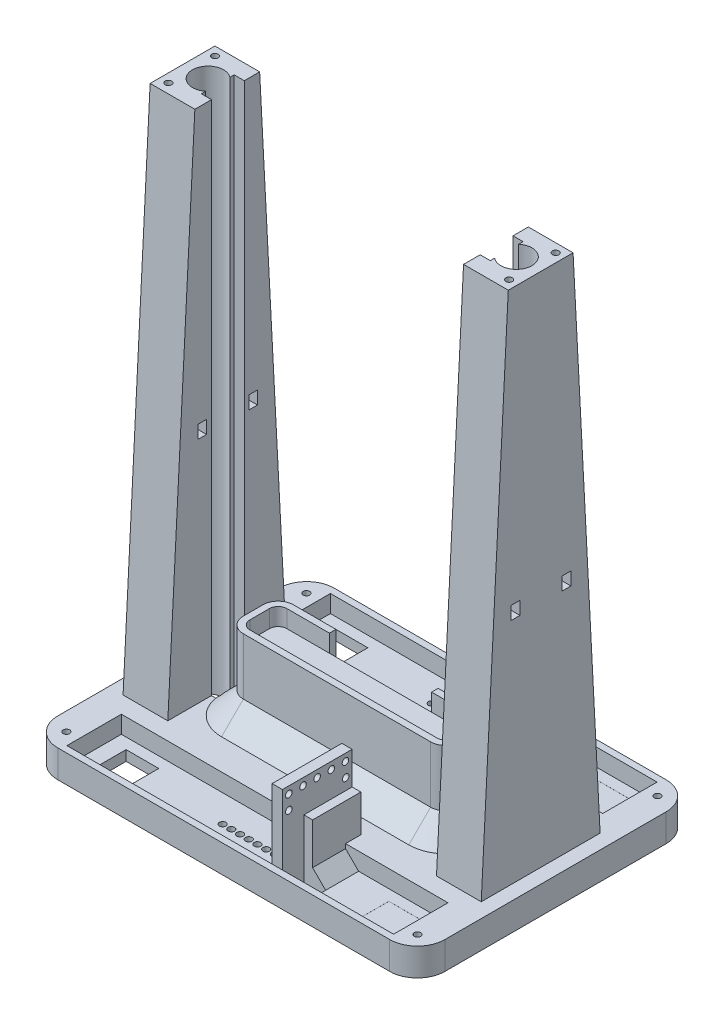
from build123d import *

# Parameters (mm, degrees)
BOSS_EXTRUDE1_DEPTH      = 12.7
SKETCH4_W                = 90
SKETCH4_H                = 13
CUT_EXTRUDE3_DEPTH       = 8
SKETCH5_W                = 5
SKETCH5_H                = 50
CUT_EXTRUDE4_DEPTH       = 8
FILLET2_R                = 2
SKETCH8_W                = 150
SKETCH8_H                = 25
CUT_EXTRUDE7_DEPTH       = 8
SKETCH9_R                = 1.5
CUT_EXTRUDE8_DEPTH       = 8
SKETCH10_W               = 15
SKETCH10_H               = 15
CUT_EXTRUDE9_DEPTH       = 8
CUT_EXTRUDE10_DEPTH      = 110.542046722
CUT_EXTRUDE10_DEPTH_BACK = 110.542046722
SKETCH11_R               = 2
SKETCH13_W               = 24.695901855
SKETCH13_H               = 54.590940943
BOSS_EXTRUDE2_DEPTH      = 242
CUT_EXTRUDE11_DEPTH      = 314.35205833
SKETCH21_W               = 4
SKETCH21_H               = 6
CUT_EXTRUDE12_DEPTH      = 297.352871748
CUT_EXTRUDE13_DEPTH      = 273.553756166
CUT_EXTRUDE13_DEPTH_BACK = 273.553756166
CUT_EXTRUDE14_DEPTH      = 273.553756166
CUT_EXTRUDE14_DEPTH_BACK = 9
SKETCH26_R               = 1.5
CUT_EXTRUDE15_START      = -237
SKETCH28_W               = 11.19655972
SKETCH28_H               = 71
CUT_EXTRUDE15_DEPTH      = 237
SKETCH29_W               = 4.719264859
SKETCH29_H               = 32
BOSS_EXTRUDE3_DEPTH      = 40
CHAMFER1_SIZE            = 10
SKETCH31_W               = 32
SKETCH31_H               = 27.767359559
BOSS_EXTRUDE4_DEPTH      = 4
SKETCH30_R               = 1.5
CUT_EXTRUDE16_DEPTH      = 6
CUT_EXTRUDE17_DEPTH      = 246.632774686
FILLET3_R                = 10
SKETCH36_W               = 25.345030469
SKETCH36_H               = 4.676078079
BOSS_EXTRUDE5_DEPTH      = 21
BOSS_EXTRUDE6_DEPTH      = 36
SKETCH38_R               = 1.5
CUT_EXTRUDE18_DEPTH      = 282.27662012
CHAMFER4_SIZE            = 10
SKETCH39_W               = 94.949747468
SKETCH39_H               = 17.949747468
BOSS_EXTRUDE7_DEPTH      = 36
SKETCH40_R               = 1.5
CUT_EXTRUDE19_DEPTH      = 261.968312253


with BuildPart() as part:
    # Sketch1 → Boss-Extrude1 (new body)
    with BuildSketch(Plane(origin=(0, 0, 0), x_dir=(1, 0, 0), z_dir=(0, 1, 0))):
        with BuildLine():
            Line((-76.2, 63.5), (76.2, 63.5))
            ThreePointArc((76.2, 63.5), (85.180256121, 59.780256121), (88.9, 50.8))
            Line((88.9, 50.8), (88.9, -50.8))
            ThreePointArc((88.9, -50.8), (85.180256121, -59.780256121), (76.2, -63.5))
            Line((76.2, -63.5), (-76.2, -63.5))
            ThreePointArc((-76.2, -63.5), (-85.180256121, -59.780256121), (-88.9, -50.8))
            Line((-88.9, -50.8), (-88.9, 50.8))
            ThreePointArc((-88.9, 50.8), (-85.180256121, 59.780256121), (-76.2, 63.5))
        make_face()
    extrude(amount=BOSS_EXTRUDE1_DEPTH)

    # Sketch4 → Cut-Extrude3 (cut)
    with BuildSketch(Plane(origin=(0, 12.7, 0), x_dir=(1, 0, 0), z_dir=(0, 1, 0))):
        Rectangle(SKETCH4_W, SKETCH4_H)
    extrude(amount=-CUT_EXTRUDE3_DEPTH, mode=Mode.SUBTRACT)

    # Sketch5 → Cut-Extrude4 (cut)
    with BuildSketch(Plane(origin=(0, 12.7, 0), x_dir=(1, 0, 0), z_dir=(0, 1, 0))):
        with Locations((-18.967535471, 31.5)):
            Rectangle(SKETCH5_W, SKETCH5_H)
        with Locations((18.967535471, 31.5)):
            Rectangle(SKETCH5_W, SKETCH5_H)
    extrude(amount=-CUT_EXTRUDE4_DEPTH, mode=Mode.SUBTRACT)

    # Fillet2
    fillet2_edges = [part.edges().sort_by_distance(p)[0] for p in [
        (-45, 4.7, 0),
        (-45, 8.7, 6.5),
        (33.233767736, 4.7, -6.5),
        (-45, 8.7, -6.5),
        (45, 4.7, 0),
        (45, 8.7, -6.5),
        (0, 4.7, 6.5),
        (45, 8.7, 6.5),
        (-45, 12.7, 0),
        (0, 12.7, 6.5),
        (45, 12.7, 0),
        (33.233767736, 12.7, -6.5),
        (0, 4.7, -6.5),
        (-33.233767736, 4.7, -6.5),
        (0, 12.7, -6.5),
        (-33.233767736, 12.7, -6.5),
        (-16.467535471, 8.7, -56.5),
        (-16.467535471, 8.7, -6.5),
        (-21.467535471, 8.7, -6.5),
        (-21.467535471, 8.7, -56.5),
        (-16.467535471, 12.7, -31.5),
        (-18.967535471, 12.7, -56.5),
        (-21.467535471, 12.7, -31.5),
        (-16.467535471, 4.7, -31.5),
        (-21.467535471, 4.7, -31.5),
        (-18.967535471, 4.7, -56.5),
        (16.467535471, 8.7, -6.5),
        (16.467535471, 8.7, -56.5),
        (21.467535471, 8.7, -56.5),
        (21.467535471, 8.7, -6.5),
        (16.467535471, 12.7, -31.5),
        (21.467535471, 12.7, -31.5),
        (18.967535471, 12.7, -56.5),
        (16.467535471, 4.7, -31.5),
        (18.967535471, 4.7, -56.5),
        (21.467535471, 4.7, -31.5),
    ]]
    fillet(fillet2_edges, radius=FILLET2_R)

    # Sketch8 → Cut-Extrude7 (cut)
    with BuildSketch(Plane(origin=(0, 12.7, 0), x_dir=(1, 0, 0), z_dir=(0, 1, 0))):
        with Locations((0, -48)):
            Rectangle(SKETCH8_W, SKETCH8_H)
        with Locations((0, 48)):
            Rectangle(SKETCH8_W, SKETCH8_H)
    extrude(amount=-CUT_EXTRUDE7_DEPTH, mode=Mode.SUBTRACT)

    # Sketch9 → Cut-Extrude8 (cut)
    with BuildSketch(Plane(origin=(0, 4.7, 0), x_dir=(1, 0, 0), z_dir=(0, 1, 0))):
        with Locations(Location((0, -48, 0), (0, 0, 270))):
            Circle(SKETCH9_R)
        with Locations(Location((4, -48, 0), (0, 0, 270))):
            Circle(SKETCH9_R)
        with Locations(Location((8, -48, 0), (0, 0, 270))):
            Circle(SKETCH9_R)
        with Locations(Location((12, -48, 0), (0, 0, 270))):
            Circle(SKETCH9_R)
        with Locations(Location((16, -48, 0), (0, 0, 270))):
            Circle(SKETCH9_R)
        with Locations(Location((-16, -48, 0), (0, 0, 270))):
            Circle(SKETCH9_R)
        with Locations(Location((-12, -48, 0), (0, 0, 270))):
            Circle(SKETCH9_R)
        with Locations(Location((-8, -48, 0), (0, 0, 270))):
            Circle(SKETCH9_R)
        with Locations(Location((-4, -48, 0), (0, 0, 270))):
            Circle(SKETCH9_R)
        with Locations(Location((-4, 48, 0), (0, 0, 270))):
            Circle(SKETCH9_R)
        with Locations(Location((-8, 48, 0), (0, 0, 270))):
            Circle(SKETCH9_R)
        with Locations(Location((-12, 48, 0), (0, 0, 270))):
            Circle(SKETCH9_R)
        with Locations(Location((-16, 48, 0), (0, 0, 270))):
            Circle(SKETCH9_R)
        with Locations(Location((16, 48, 0), (0, 0, 270))):
            Circle(SKETCH9_R)
        with Locations(Location((12, 48, 0), (0, 0, 270))):
            Circle(SKETCH9_R)
        with Locations(Location((8, 48, 0), (0, 0, 270))):
            Circle(SKETCH9_R)
        with Locations(Location((4, 48, 0), (0, 0, 270))):
            Circle(SKETCH9_R)
        with Locations(Location((0, 48, 0), (0, 0, 270))):
            Circle(SKETCH9_R)
    extrude(amount=-CUT_EXTRUDE8_DEPTH, mode=Mode.SUBTRACT)

    # Sketch10 → Cut-Extrude9 (cut)
    with BuildSketch(Plane(origin=(0, 4.7, 0), x_dir=(1, 0, 0), z_dir=(0, 1, 0))):
        with Locations((-60.317583888, -48)):
            Rectangle(SKETCH10_W, SKETCH10_H)
        with Locations((60.317583888, -48)):
            Rectangle(SKETCH10_W, SKETCH10_H)
        with Locations((60.317583888, 48)):
            Rectangle(SKETCH10_W, SKETCH10_H)
        with Locations((-60.317583888, 48)):
            Rectangle(SKETCH10_W, SKETCH10_H)
    extrude(amount=-CUT_EXTRUDE9_DEPTH, mode=Mode.SUBTRACT)

    # Sketch11 → Cut-Extrude10 (cut, two sides: drawn at the far end of the back side and taken through both)
    with BuildSketch(Plane(origin=(0, 4.7, 0), x_dir=(1, 0, 0), z_dir=(0, 1, 0)).offset(-CUT_EXTRUDE10_DEPTH_BACK)):
        with Locations(Location((-19.497261117, 37.214545157, 0), (0, 0, 270))):
            Circle(SKETCH11_R)
        with Locations(Location((18.951015186, 37.432150821, 0), (0, 0, 270))):
            Circle(SKETCH11_R)
    extrude(amount=CUT_EXTRUDE10_DEPTH + CUT_EXTRUDE10_DEPTH_BACK, mode=Mode.SUBTRACT)

    # Sketch13 → Boss-Extrude2 (add)
    with BuildSketch(Plane(origin=(0, 12.7, 0), x_dir=(1, 0, 0), z_dir=(0, 1, 0))):
        with Locations((-69.881159569, -0.185683473)):
            Rectangle(SKETCH13_W, SKETCH13_H)
    boss_extrude2 = extrude(amount=BOSS_EXTRUDE2_DEPTH)

    # Sketch17 → Cut-Extrude11 (cut, symmetric)
    with BuildSketch(Plane.ZY.offset(82.229110497)):
        Polygon((-27.109786999, 12.7), (-14.689143309, 249.7), (15.060510254, 249.7), (27.481153944, 12.7), (27.481153944, 254.7), (-27.109786999, 254.7), align=None)
    cut_extrude11 = extrude(amount=CUT_EXTRUDE11_DEPTH, both=True, mode=Mode.SUBTRACT)

    # Mirror1: Boss-Extrude2, Cut-Extrude11 across plane
    add(boss_extrude2.mirror(Plane(origin=(0, 0, 0), x_dir=(0, 0, 1), z_dir=(1, 0, 0))))
    add(cut_extrude11.mirror(Plane(origin=(0, 0, 0), x_dir=(0, 0, 1), z_dir=(1, 0, 0))), mode=Mode.SUBTRACT)

    # Sketch21 → Cut-Extrude12 (cut, symmetric)
    with BuildSketch(Plane.ZY.offset(-57.533208642)):
        with Locations((11.706235249, 120.7)):
            Rectangle(SKETCH21_W, SKETCH21_H)
    cut_extrude12 = extrude(amount=CUT_EXTRUDE12_DEPTH, both=True, mode=Mode.SUBTRACT)

    # Mirror2: Cut-Extrude12 across plane
    add(cut_extrude12.mirror(Plane.XY), mode=Mode.SUBTRACT)

    # Sketch25 → Cut-Extrude13 (cut, two sides: drawn at the far end of the back side and taken through both)
    with BuildSketch(Plane(origin=(0, 249.7, 0), x_dir=(1, 0, 0), z_dir=(0, 1, 0)).offset(-CUT_EXTRUDE13_DEPTH_BACK)):
        with BuildLine():
            Line((-66.3346358, -5.419713844), (-66.3346358, -7.436467572))
            Line((-66.3346358, -7.436467572), (-57.317356687, -7.436467572))
            Line((-57.317356687, -7.436467572), (-57.317356687, 7.648938074))
            Line((-57.317356687, 7.648938074), (-66.3346358, 7.648938074))
            Line((-66.3346358, 7.648938074), (-66.3346358, 5.632184346))
            ThreePointArc((-66.3346358, 5.632184346), (-77.926558496, 0.106235251), (-66.3346358, -5.419713844))
        make_face()
        with BuildLine():
            Line((66.3346358, 7.648938074), (66.3346358, 5.632184346))
            ThreePointArc((66.3346358, 5.632184346), (77.926558496, 0.106235251), (66.3346358, -5.419713844))
            Line((66.3346358, -5.419713844), (66.3346358, -7.436467572))
            Line((66.3346358, -7.436467572), (57.317356687, -7.436467572))
            Line((57.317356687, -7.436467572), (57.317356687, 7.648938074))
            Line((57.317356687, 7.648938074), (66.3346358, 7.648938074))
        make_face()
    extrude(amount=CUT_EXTRUDE13_DEPTH + CUT_EXTRUDE13_DEPTH_BACK, mode=Mode.SUBTRACT)

    # Sketch26 → Cut-Extrude14 (cut, two sides: drawn at the far end of the back side and taken through both)
    with BuildSketch(Plane(origin=(0, 249.7, 0), x_dir=(1, 0, 0), z_dir=(0, 1, 0)).offset(-CUT_EXTRUDE14_DEPTH_BACK)):
        with Locations(Location((-78.229110497, 10.689143309, 0), (0, 0, 90))):
            Circle(SKETCH26_R)
        with Locations(Location((-78.229110497, -10.689143309, 0), (0, 0, 90))):
            Circle(SKETCH26_R)
        with Locations(Location((78.229110497, -10.689143309, 0), (0, 0, 90))):
            Circle(SKETCH26_R)
        with Locations(Location((78.229110497, 10.689143309, 0), (0, 0, 90))):
            Circle(SKETCH26_R)
    extrude(amount=CUT_EXTRUDE14_DEPTH + CUT_EXTRUDE14_DEPTH_BACK, mode=Mode.SUBTRACT)

    # Sketch28 → Cut-Extrude15 (cut)
    with BuildSketch(Plane(origin=(0, 249.7, 0), x_dir=(1, 0, 0), z_dir=(0, 1, 0)).offset(CUT_EXTRUDE15_START)):
        with Locations((-56.08903549, 0)):
            Rectangle(SKETCH28_W, SKETCH28_H)
    cut_extrude15 = extrude(amount=CUT_EXTRUDE15_DEPTH, mode=Mode.SUBTRACT)

    # Mirror3: Cut-Extrude15 across plane
    add(cut_extrude15.mirror(Plane(origin=(0, 0, 0), x_dir=(0, 0, 1), z_dir=(1, 0, 0))), mode=Mode.SUBTRACT)

    # Sketch29 → Boss-Extrude3 (add)
    with BuildSketch(Plane(origin=(0, 4.7, 0), x_dir=(1, 0, 0), z_dir=(0, 1, 0))):
        with Locations((21.586267037, -44.47650522)):
            Rectangle(SKETCH29_W, SKETCH29_H)
    boss_extrude3 = extrude(amount=BOSS_EXTRUDE3_DEPTH)

    # Chamfer1
    chamfer1_edges = [part.edges().sort_by_distance(p)[0] for p in [
        (23.945899466, 4.7, 47.98825261),
    ]]
    chamfer(chamfer1_edges, length=CHAMFER1_SIZE)

    # Sketch31 → Boss-Extrude4 (add)
    with BuildSketch(Plane(origin=(23.945899466, 0, 0), x_dir=(0, 0, -1), z_dir=(1, 0, 0))):
        with Locations((-44.47650522, 15.816320221)):
            Rectangle(SKETCH31_W, SKETCH31_H)
    boss_extrude4 = extrude(amount=BOSS_EXTRUDE4_DEPTH)

    # Sketch30 → Cut-Extrude16 (cut)
    with BuildSketch(Plane(origin=(23.945899466, 0, 0), x_dir=(0, 0, -1), z_dir=(1, 0, 0))):
        with Locations((-44.534122475, 41.44870389)):
            Circle(SKETCH30_R)
        with Locations((-51.034122475, 41.44870389)):
            Circle(SKETCH30_R)
        with Locations((-57.534122475, 41.44870389)):
            Circle(SKETCH30_R)
        with Locations((-57.534122475, 34.94870389)):
            Circle(SKETCH30_R)
        with Locations((-38.034370442, 41.391927945)):
            Circle(SKETCH30_R)
        with Locations((-31.534374224, 41.384916129)):
            Circle(SKETCH30_R)
    cut_extrude16 = extrude(amount=-CUT_EXTRUDE16_DEPTH, mode=Mode.SUBTRACT)

    # Sketch34 → Cut-Extrude17 (cut, through all)
    with BuildSketch(Plane(origin=(0, 29.7, 0), x_dir=(1, 0, 0), z_dir=(0, 1, 0))):
        Polygon((23.945899466, -50.632656718), (30.945899466, -50.632656718), (33.945899466, -50.632656718), (33.945899466, -60.47650522), (30.945899466, -60.47650522), (23.945899466, -60.47650522), align=None)
    cut_extrude17 = extrude(amount=-CUT_EXTRUDE17_DEPTH, mode=Mode.SUBTRACT)

    # Mirror9: Boss-Extrude3, Boss-Extrude4, Cut-Extrude16, Cut-Extrude17 across plane
    add(boss_extrude3.mirror(Plane.XY))
    add(boss_extrude4.mirror(Plane.XY))
    add(cut_extrude16.mirror(Plane.XY), mode=Mode.SUBTRACT)
    add(cut_extrude17.mirror(Plane.XY), mode=Mode.SUBTRACT)

    # Fillet3
    # the kernel refuses this fillet: 10 mm, written as the material it adds along each edge
    with BuildSketch(Plane(origin=(27.945899466, 4.7, -50.632656718), x_dir=(0, 1, 0), z_dir=(0, 0, 1))) as fillet3_piece_1_section:
        with BuildLine():
            CenterArc((FILLET3_R, -FILLET3_R), FILLET3_R, 90, 90)
            Line((0, -FILLET3_R), (0, 0))
            Line((0, 0), (FILLET3_R, 0))
        make_face()
    fillet3_piece_1 = extrude(amount=40.132656718, mode=Mode.PRIVATE)
    fillet3_piece_1 = split(fillet3_piece_1, bisect_by=Plane(origin=(28.006405342, 13.198984242, -28.47650522), z_dir=(0, 0, -1)), keep=Keep.TOP, mode=Mode.PRIVATE)
    add(fillet3_piece_1)

    # Sketch36 → Boss-Extrude5 (add)
    with BuildSketch(Plane.ZY.offset(-67.817583888)):
        with Locations((-50.585946464, 2.33803904)):
            Rectangle(SKETCH36_W, SKETCH36_H)
    boss_extrude5 = extrude(amount=BOSS_EXTRUDE5_DEPTH)

    # Mirror10: Boss-Extrude5 across plane
    add(boss_extrude5.mirror(Plane.XY))

    # Sketch37 → Boss-Extrude6 (add)
    with BuildSketch(Plane(origin=(0, 12.7, 0), x_dir=(1, 0, 0), z_dir=(0, 1, 0))):
        with BuildLine():
            Line((23.467535471, 11.5), (43, 11.5))
            ThreePointArc((43, 11.5), (47.949747468, 9.449747468), (50, 4.5))
            Line((50, 4.5), (50, -4.5))
            ThreePointArc((50, -4.5), (47.949747468, -9.449747468), (43, -11.5))
            Line((43, -11.5), (-43, -11.5))
            ThreePointArc((-43, -11.5), (-47.949747468, -9.449747468), (-50, -4.5))
            Line((-50, -4.5), (-50, 4.5))
            ThreePointArc((-50, 4.5), (-47.949747468, 9.449747468), (-43, 11.5))
            Line((-43, 11.5), (-23.467535471, 11.5))
            Line((-23.467535471, 11.5), (-23.467535471, 8.5))
            Line((-23.467535471, 8.5), (-43, 8.5))
            ThreePointArc((-43, 8.5), (-45.828427125, 7.328427125), (-47, 4.5))
            Line((-47, 4.5), (-47, -4.5))
            ThreePointArc((-47, -4.5), (-45.828427125, -7.328427125), (-43, -8.5))
            Line((-43, -8.5), (43, -8.5))
            ThreePointArc((43, -8.5), (45.828427125, -7.328427125), (47, -4.5))
            Line((47, -4.5), (47, 4.5))
            ThreePointArc((47, 4.5), (45.828427125, 7.328427125), (43, 8.5))
            Line((43, 8.5), (23.467535471, 8.5))
            Line((23.467535471, 8.5), (23.467535471, 11.5))
        make_face()
    extrude(amount=BOSS_EXTRUDE6_DEPTH)

    # Sketch38 → Cut-Extrude18 (cut, through all)
    with BuildSketch(Plane(origin=(23.945899466, 0, 0), x_dir=(0, 0, -1), z_dir=(1, 0, 0))):
        with Locations((31.428457113, 34.884916129)):
            Circle(SKETCH38_R)
    cut_extrude18 = extrude(amount=-CUT_EXTRUDE18_DEPTH, mode=Mode.SUBTRACT)

    # Chamfer4
    # the kernel refuses this chamfer: 10 mm, written as the material it adds along each edge
    with BuildSketch(Plane(origin=(-43, 12.7, -11.5), x_dir=(0, -0.027495876610586317, -0.9996219169112968), z_dir=(1, 0, 0)), Plane(origin=(23.467535471, 12.7, -11.5), x_dir=(0, -0.027495876610586317, -0.9996219169112968), z_dir=(1, 0, 0))) as chamfer4_piece_1:
        Polygon((CHAMFER4_SIZE * 0.999621916911, CHAMFER4_SIZE * 0.0274958766106), (-CHAMFER4_SIZE * 0.0274958766106, CHAMFER4_SIZE * 0.999621916911), (0, 0), align=None)
    extrude(amount=19.532464529)
    with BuildSketch(Plane(origin=(-43, 12.7, -4.5), x_dir=(-1, 0, 0), z_dir=(0, 0, 1))) as chamfer4_piece_2_section:
        Polygon((7 + CHAMFER4_SIZE, 0), (7, -CHAMFER4_SIZE), (7, 0), align=None)
    chamfer4_piece_2 = revolve(axis=Axis((-43, 12.7, -4.5), (0, -1, 0)), revolution_arc=90, mode=Mode.PRIVATE)
    chamfer4_piece_2 = split(chamfer4_piece_2, bisect_by=Plane(origin=(-57.317356687, 16.238452872, -6.095772707), z_dir=(1, 0, 0)), keep=Keep.TOP, mode=Mode.PRIVATE)
    chamfer4_piece_2 = split(chamfer4_piece_2, bisect_by=Plane(origin=(-52.657060967, 16.238452872, -7.648938074), z_dir=(0, 0, 1)), keep=Keep.TOP, mode=Mode.PRIVATE)
    add(chamfer4_piece_2)
    with BuildSketch(Plane(origin=(-43, 12.7, -4.5), x_dir=(-1, 0, 0), z_dir=(0, 0, 1))) as chamfer4_piece_3_section:
        Polygon((7 + CHAMFER4_SIZE, 0), (7, -CHAMFER4_SIZE), (7, 0), align=None)
    chamfer4_piece_3 = revolve(axis=Axis((-43, 12.7, -4.5), (0, -1, 0)), revolution_arc=90, mode=Mode.PRIVATE)
    chamfer4_piece_3 = split(chamfer4_piece_3, bisect_by=Plane(origin=(-57.317356687, 13.012814244, -9.602987475), z_dir=(-1, 0, 0)), keep=Keep.TOP, mode=Mode.PRIVATE)
    chamfer4_piece_3 = split(chamfer4_piece_3, bisect_by=Plane(origin=(-58.087585958, 13.012814244, -7.648938074), z_dir=(0, 0, -1)), keep=Keep.TOP, mode=Mode.PRIVATE)
    add(chamfer4_piece_3)
    with BuildSketch(Plane(origin=(-43, 12.7, -4.5), x_dir=(-1, 0, 0), z_dir=(0, 0, 1))) as chamfer4_piece_4_section:
        Polygon((7 + CHAMFER4_SIZE, 0), (7, -CHAMFER4_SIZE), (7, 0), align=None)
    chamfer4_piece_4 = revolve(axis=Axis((-43, 12.7, -4.5), (0, -1, 0)), revolution_arc=90, mode=Mode.PRIVATE)
    chamfer4_piece_4 = split(chamfer4_piece_4, bisect_by=Plane(origin=(-57.317356687, 15.624530445, -12.825816579), z_dir=(1, 0, 0)), keep=Keep.TOP, mode=Mode.PRIVATE)
    chamfer4_piece_4 = split(chamfer4_piece_4, bisect_by=Plane(origin=(-49.026365312, 15.624530445, -7.648938074), z_dir=(0, 0, -1)), keep=Keep.TOP, mode=Mode.PRIVATE)
    add(chamfer4_piece_4)
    with BuildSketch(Plane(origin=(43, 12.7, -4.5), x_dir=(0, 0, -1), z_dir=(-1, 0, 0))) as chamfer4_piece_5_section:
        Polygon((7 + CHAMFER4_SIZE, 0), (7, -CHAMFER4_SIZE), (7, 0), align=None)
    chamfer4_piece_5 = revolve(axis=Axis((43, 12.7, -4.5), (0, -1, 0)), revolution_arc=90, mode=Mode.PRIVATE)
    chamfer4_piece_5 = split(chamfer4_piece_5, bisect_by=Plane(origin=(57.317356687, 15.624530338, -12.825816766), z_dir=(-1, 0, 0)), keep=Keep.TOP, mode=Mode.PRIVATE)
    chamfer4_piece_5 = split(chamfer4_piece_5, bisect_by=Plane(origin=(49.026365357, 15.624530338, -7.648938074), z_dir=(0, 0, -1)), keep=Keep.TOP, mode=Mode.PRIVATE)
    add(chamfer4_piece_5)
    with BuildSketch(Plane(origin=(43, 12.7, -4.5), x_dir=(0, 0, -1), z_dir=(-1, 0, 0))) as chamfer4_piece_6_section:
        Polygon((7 + CHAMFER4_SIZE, 0), (7, -CHAMFER4_SIZE), (7, 0), align=None)
    chamfer4_piece_6 = revolve(axis=Axis((43, 12.7, -4.5), (0, -1, 0)), revolution_arc=90, mode=Mode.PRIVATE)
    chamfer4_piece_6 = split(chamfer4_piece_6, bisect_by=Plane(origin=(57.317356687, 16.238452877, -6.095772706), z_dir=(-1, 0, 0)), keep=Keep.TOP, mode=Mode.PRIVATE)
    chamfer4_piece_6 = split(chamfer4_piece_6, bisect_by=Plane(origin=(52.657060968, 16.238452877, -7.648938074), z_dir=(0, 0, 1)), keep=Keep.TOP, mode=Mode.PRIVATE)
    add(chamfer4_piece_6)
    with BuildSketch(Plane(origin=(43, 12.7, -4.5), x_dir=(0, 0, -1), z_dir=(-1, 0, 0))) as chamfer4_piece_7_section:
        Polygon((7 + CHAMFER4_SIZE, 0), (7, -CHAMFER4_SIZE), (7, 0), align=None)
    chamfer4_piece_7 = revolve(axis=Axis((43, 12.7, -4.5), (0, -1, 0)), revolution_arc=90, mode=Mode.PRIVATE)
    chamfer4_piece_7 = split(chamfer4_piece_7, bisect_by=Plane(origin=(57.317356687, 13.012814239, -9.602987474), z_dir=(1, 0, 0)), keep=Keep.TOP, mode=Mode.PRIVATE)
    chamfer4_piece_7 = split(chamfer4_piece_7, bisect_by=Plane(origin=(58.08758596, 13.012814239, -7.648938074), z_dir=(0, 0, -1)), keep=Keep.TOP, mode=Mode.PRIVATE)
    add(chamfer4_piece_7)
    with BuildSketch(Plane(origin=(-50, 12.7, 4.5), x_dir=(-0.9996219169112968, -0.027495876610586317, 0), z_dir=(0, 0, -1))) as chamfer4_piece_8_section:
        Polygon((CHAMFER4_SIZE * 0.999621916911, CHAMFER4_SIZE * 0.0274958766106), (-CHAMFER4_SIZE * 0.0274958766106, CHAMFER4_SIZE * 0.999621916911), (0, 0), align=None)
    chamfer4_piece_8 = extrude(amount=9, mode=Mode.PRIVATE)
    chamfer4_piece_8 = split(chamfer4_piece_8, bisect_by=Plane(origin=(-57.317356687, 16.244343615, 0), z_dir=(1, 0, 0)), keep=Keep.TOP, mode=Mode.PRIVATE)
    add(chamfer4_piece_8)
    with BuildSketch(Plane(origin=(50, 12.7, -4.5), x_dir=(0.9996219169112968, -0.027495876610586317, 0), z_dir=(0, 0, 1))) as chamfer4_piece_9_section:
        Polygon((CHAMFER4_SIZE * 0.999621916911, CHAMFER4_SIZE * 0.0274958766106), (-CHAMFER4_SIZE * 0.0274958766106, CHAMFER4_SIZE * 0.999621916911), (0, 0), align=None)
    chamfer4_piece_9 = extrude(amount=9, mode=Mode.PRIVATE)
    chamfer4_piece_9 = split(chamfer4_piece_9, bisect_by=Plane(origin=(57.317356687, 16.244343615, 0), z_dir=(-1, 0, 0)), keep=Keep.TOP, mode=Mode.PRIVATE)
    add(chamfer4_piece_9)
    with BuildSketch(Plane(origin=(-43, 12.7, 4.5), x_dir=(0, 0, 1), z_dir=(1, 0, 0))) as chamfer4_piece_10_section:
        Polygon((7 + CHAMFER4_SIZE, 0), (7, -CHAMFER4_SIZE), (7, 0), align=None)
    chamfer4_piece_10 = revolve(axis=Axis((-43, 12.7, 4.5), (0, -1, 0)), revolution_arc=90, mode=Mode.PRIVATE)
    chamfer4_piece_10 = split(chamfer4_piece_10, bisect_by=Plane(origin=(-49.080103114, 15.634328443, 7.436467572), z_dir=(0, 0, 1)), keep=Keep.TOP, mode=Mode.PRIVATE)
    chamfer4_piece_10 = split(chamfer4_piece_10, bisect_by=Plane(origin=(-57.317356687, 15.634328443, 12.74040293), z_dir=(1, 0, 0)), keep=Keep.TOP, mode=Mode.PRIVATE)
    add(chamfer4_piece_10)
    with BuildSketch(Plane(origin=(-43, 12.7, 4.5), x_dir=(0, 0, 1), z_dir=(1, 0, 0))) as chamfer4_piece_11_section:
        Polygon((7 + CHAMFER4_SIZE, 0), (7, -CHAMFER4_SIZE), (7, 0), align=None)
    chamfer4_piece_11 = revolve(axis=Axis((-43, 12.7, 4.5), (0, -1, 0)), revolution_arc=90, mode=Mode.PRIVATE)
    chamfer4_piece_11 = split(chamfer4_piece_11, bisect_by=Plane(origin=(-52.680466314, 16.239055522, 7.436467572), z_dir=(0, 0, -1)), keep=Keep.TOP, mode=Mode.PRIVATE)
    chamfer4_piece_11 = split(chamfer4_piece_11, bisect_by=Plane(origin=(-57.317356687, 16.239055522, 5.985432566), z_dir=(1, 0, 0)), keep=Keep.TOP, mode=Mode.PRIVATE)
    add(chamfer4_piece_11)
    with BuildSketch(Plane(origin=(-43, 12.7, 4.5), x_dir=(0, 0, 1), z_dir=(1, 0, 0))) as chamfer4_piece_12_section:
        Polygon((7 + CHAMFER4_SIZE, 0), (7, -CHAMFER4_SIZE), (7, 0), align=None)
    chamfer4_piece_12 = revolve(axis=Axis((-43, 12.7, 4.5), (0, -1, 0)), revolution_arc=90, mode=Mode.PRIVATE)
    chamfer4_piece_12 = split(chamfer4_piece_12, bisect_by=Plane(origin=(-58.100534408, 13.027719663, 7.436467572), z_dir=(0, 0, 1)), keep=Keep.TOP, mode=Mode.PRIVATE)
    chamfer4_piece_12 = split(chamfer4_piece_12, bisect_by=Plane(origin=(-57.317356687, 13.027719663, 9.462272022), z_dir=(-1, 0, 0)), keep=Keep.TOP, mode=Mode.PRIVATE)
    add(chamfer4_piece_12)
    with BuildSketch(Plane(origin=(43, 12.7, 4.5), x_dir=(1, 0, 0), z_dir=(0, 0, -1))) as chamfer4_piece_13_section:
        Polygon((7 + CHAMFER4_SIZE, 0), (7, -CHAMFER4_SIZE), (7, 0), align=None)
    chamfer4_piece_13 = revolve(axis=Axis((43, 12.7, 4.5), (0, -1, 0)), revolution_arc=90, mode=Mode.PRIVATE)
    chamfer4_piece_13 = split(chamfer4_piece_13, bisect_by=Plane(origin=(52.680466316, 16.239055515, 7.436467572), z_dir=(0, 0, -1)), keep=Keep.TOP, mode=Mode.PRIVATE)
    chamfer4_piece_13 = split(chamfer4_piece_13, bisect_by=Plane(origin=(57.317356687, 16.239055515, 5.985432569), z_dir=(-1, 0, 0)), keep=Keep.TOP, mode=Mode.PRIVATE)
    add(chamfer4_piece_13)
    with BuildSketch(Plane(origin=(43, 12.7, 4.5), x_dir=(1, 0, 0), z_dir=(0, 0, -1))) as chamfer4_piece_14_section:
        Polygon((7 + CHAMFER4_SIZE, 0), (7, -CHAMFER4_SIZE), (7, 0), align=None)
    chamfer4_piece_14 = revolve(axis=Axis((43, 12.7, 4.5), (0, -1, 0)), revolution_arc=90, mode=Mode.PRIVATE)
    chamfer4_piece_14 = split(chamfer4_piece_14, bisect_by=Plane(origin=(58.100534404, 13.027719668, 7.436467572), z_dir=(0, 0, 1)), keep=Keep.TOP, mode=Mode.PRIVATE)
    chamfer4_piece_14 = split(chamfer4_piece_14, bisect_by=Plane(origin=(57.317356687, 13.027719668, 9.462272024), z_dir=(1, 0, 0)), keep=Keep.TOP, mode=Mode.PRIVATE)
    add(chamfer4_piece_14)
    with BuildSketch(Plane(origin=(43, 12.7, 4.5), x_dir=(1, 0, 0), z_dir=(0, 0, -1))) as chamfer4_piece_15_section:
        Polygon((7 + CHAMFER4_SIZE, 0), (7, -CHAMFER4_SIZE), (7, 0), align=None)
    chamfer4_piece_15 = revolve(axis=Axis((43, 12.7, 4.5), (0, -1, 0)), revolution_arc=90, mode=Mode.PRIVATE)
    chamfer4_piece_15 = split(chamfer4_piece_15, bisect_by=Plane(origin=(49.080103071, 15.634328552, 7.436467572), z_dir=(0, 0, 1)), keep=Keep.TOP, mode=Mode.PRIVATE)
    chamfer4_piece_15 = split(chamfer4_piece_15, bisect_by=Plane(origin=(57.317356687, 15.634328552, 12.740402741), z_dir=(-1, 0, 0)), keep=Keep.TOP, mode=Mode.PRIVATE)
    add(chamfer4_piece_15)
    with BuildSketch(Plane(origin=(43, 12.7, 11.5), x_dir=(0, -0.027495876610586317, 0.9996219169112968), z_dir=(-1, 0, 0))) as chamfer4_piece_16:
        Polygon((CHAMFER4_SIZE * 0.999621916911, CHAMFER4_SIZE * 0.0274958766106), (-CHAMFER4_SIZE * 0.0274958766106, CHAMFER4_SIZE * 0.999621916911), (0, 0), align=None)
    extrude(amount=86)

    # Sketch39 → Boss-Extrude7 (add)
    with BuildSketch(Plane(origin=(0, 4.7, 0), x_dir=(1, 0, 0), z_dir=(0, 1, 0))):
        with Locations((0.474873734, -0.474873734)):
            Rectangle(SKETCH39_W, SKETCH39_H)
    extrude(amount=BOSS_EXTRUDE7_DEPTH)

    # Mirror11: Cut-Extrude18 across plane
    add(cut_extrude18.mirror(Plane.XY), mode=Mode.SUBTRACT)

    # Sketch40 → Cut-Extrude19 (cut, through all)
    with BuildSketch(Plane(origin=(0, 12.7, 0), x_dir=(1, 0, 0), z_dir=(0, 1, 0))):
        with Locations(Location((-80.621694086, 55.088576219, 0), (0, 0, 270))):
            Circle(SKETCH40_R)
        with Locations(Location((80.621694086, 55.088576219, 0), (0, 0, 270))):
            Circle(SKETCH40_R)
        with Locations(Location((80.621694086, -55.088576219, 0), (0, 0, 270))):
            Circle(SKETCH40_R)
        with Locations(Location((-80.621694086, -55.088576219, 0), (0, 0, 270))):
            Circle(SKETCH40_R)
    extrude(amount=-CUT_EXTRUDE19_DEPTH, mode=Mode.SUBTRACT)


solid = part.part
